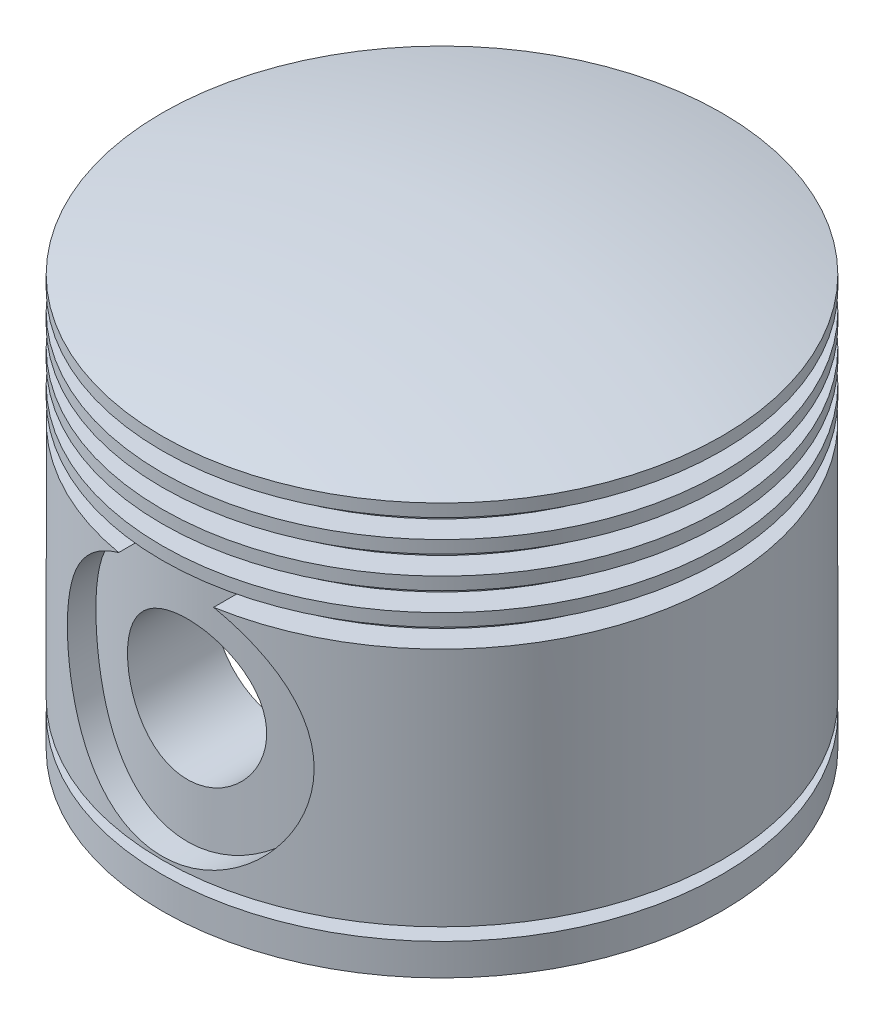
from build123d import *
from build123d.topology import SkipClean

# Parameters (mm, degrees)
BOSS_EXTRUDE4_REACH                 = 121.017
BOSS_EXTRUDE4_END_RADIUS            = 37
BOSS_EXTRUDE4_START                 = 25
SKETCH42_R                          = 19.5
CUT_EXTRUDE4_REACH                  = 122.023
CUT_EXTRUDE4_END_RADIUS             = 44.23595367
SKETCH44_R                          = 19.5
CUT_EXTRUDE4_DIRECTION_2_REACH      = 122.023
CUT_EXTRUDE4_DIRECTION_2_END_RADIUS = 40.23595367
SKETCH46_R                          = 11
CUT_EXTRUDE5_DEPTH                  = 95.017168886


# Read off the part's stored shape, not the designer's step: Mirror1
with BuildPart() as part:
    # Sketch1 → Revolve1 (revolve)
    with BuildSketch(Plane.XY, mode=Mode.PRIVATE) as revolve1_sk:
        with BuildLine():
            Line((-44.23595367, 0), (-37, 0))
            Line((-37, 0), (-37, 62))
            Line((-37, 62), (0, 62))
            Line((0, 62), (0, 70.182332128))
            ThreePointArc((0, 70.182332128), (-22.271164603, 68.898764042), (-44.23595367, 65))
            Line((-44.23595367, 65), (-44.23595367, 63))
            Line((-44.23595367, 63), (-40.23595367, 63))
            Line((-40.23595367, 63), (-40.23595367, 60))
            Line((-40.23595367, 60), (-44.23595367, 60))
            Line((-44.23595367, 60), (-44.23595367, 58))
            Line((-44.23595367, 58), (-40.23595367, 58))
            Line((-40.23595367, 58), (-40.23595367, 55))
            Line((-40.23595367, 55), (-44.23595367, 55))
            Line((-44.23595367, 55), (-44.23595367, 53))
            Line((-44.23595367, 53), (-40.23595367, 53))
            Line((-40.23595367, 53), (-40.23595367, 50))
            Line((-40.23595367, 50), (-44.23595367, 50))
            Line((-44.23595367, 50), (-44.23595367, 48))
            Line((-44.23595367, 48), (-40.23595367, 48))
            Line((-40.23595367, 48), (-40.23595367, 45))
            Line((-40.23595367, 45), (-44.23595367, 45))
            Line((-44.23595367, 45), (-44.23595367, 7))
            Line((-44.23595367, 7), (-40.23595367, 7))
            Line((-40.23595367, 7), (-40.23595367, 5))
            Line((-40.23595367, 5), (-44.23595367, 5))
            Line((-44.23595367, 5), (-44.23595367, 0))
        make_face()
    revolve(revolve1_sk.sketch.rotate(Axis((0, -6.530383695, 0), (0, 1, 0)), 270), axis=Axis((0, -6.530383695, 0), (0, 1, 0)))

    # Boss-Extrude4: up to this cylinder (the profile starts inside it)
    boss_extrude4_end = Plane(origin=(0, 27, 0), z_dir=(0, -1, 0)) * Cylinder(BOSS_EXTRUDE4_END_RADIUS, 317.034, mode=Mode.PRIVATE)
    # Sketch42 → Boss-Extrude4 (add, up to the surface)
    with BuildSketch(Plane.XY.offset(BOSS_EXTRUDE4_START), mode=Mode.PRIVATE) as boss_extrude4_sk1:
        with Locations(Location((0, 27, 0), (0, 0, 180))):
            Circle(SKETCH42_R)
    boss_extrude4_tool1 = extrude(boss_extrude4_sk1.sketch, amount=BOSS_EXTRUDE4_REACH, mode=Mode.PRIVATE) & boss_extrude4_end
    add(boss_extrude4_tool1.solids().sort_by_distance((0, 27, 25))[0])

    # Cut-Extrude4: up to this cylinder (the profile starts inside it)
    cut_extrude4_end = Plane(origin=(0, 27, 0), z_dir=(0, -1, 0)) * Cylinder(CUT_EXTRUDE4_END_RADIUS, 333.51790734, mode=Mode.PRIVATE)
    # Sketch44 → Cut-Extrude4 (cut, up to the surface)
    with BuildSketch(Plane.XY.offset(42.5), mode=Mode.PRIVATE) as cut_extrude4_sk1:
        with Locations(Location((0, 27, 0), (0, 0, 180))):
            Circle(SKETCH44_R)
    cut_extrude4_tool1 = extrude(cut_extrude4_sk1.sketch, amount=CUT_EXTRUDE4_REACH, mode=Mode.PRIVATE) & cut_extrude4_end
    add(cut_extrude4_tool1.solids().sort_by_distance((0, 27, 42.5))[0], mode=Mode.SUBTRACT)

    # Cut-Extrude4 direction 2: up to this cylinder (the profile starts outside it)
    cut_extrude4_direction_2_end = Plane(origin=(0, 27, 0), z_dir=(0, -1, 0)) * Cylinder(CUT_EXTRUDE4_DIRECTION_2_END_RADIUS, 325.51790734, mode=Mode.PRIVATE)
    # Sketch44 → Cut-Extrude4 direction 2 (cut, up to the surface)
    with BuildSketch(Plane.XY.offset(42.5), mode=Mode.PRIVATE) as cut_extrude4_direction_2_sk1:
        with Locations(Location((0, 27, 0), (0, 0, 180))):
            Circle(SKETCH44_R)
    cut_extrude4_direction_2_tool1 = extrude(cut_extrude4_direction_2_sk1.sketch, amount=-CUT_EXTRUDE4_DIRECTION_2_REACH, mode=Mode.PRIVATE) - cut_extrude4_direction_2_end
    add(cut_extrude4_direction_2_tool1.solids().sort_by_distance((0, 27, 42.5))[0], mode=Mode.SUBTRACT)

    # Sketch46 → Cut-Extrude5 (cut, through all)
    with BuildSketch(Plane.XY):
        with Locations(Location((0, 27, 0), (0, 0, 180))):
            Circle(SKETCH46_R)
    extrude(amount=CUT_EXTRUDE5_DEPTH, mode=Mode.SUBTRACT)

    # Mirror1
    split(bisect_by=Plane.XY, keep=Keep.TOP)

    # Mirror1 2: part across plane


with BuildPart() as part_1:
    with SkipClean():  # the faces are left unmerged after this step: merging them gives an invalid solid
        add(part.part)
        add(part.part.mirror(Plane.XY))


solid = part_1.part
